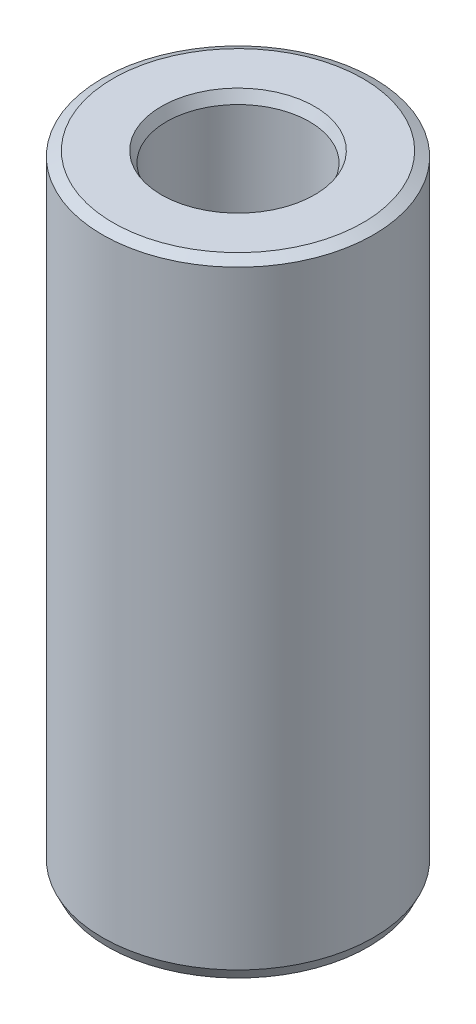
from build123d import *
from OCP.BRepFilletAPI import BRepFilletAPI_MakeChamfer

# Parameters (mm, degrees)
SKETCH1_R           = 50
BOSS_EXTRUDE1_DEPTH = 230.315111073
SKETCH2_R           = 26.370165527
CUT_EXTRUDE1_DEPTH  = 241.925404199
CHAMFER1_SIZE       = 1.895094903
CHAMFER1_SIZE2      = 3.914105272


with BuildPart() as part:
    # Sketch1 → Boss-Extrude1 (new body)
    with BuildSketch(Plane(origin=(0, 0, 0), x_dir=(1, 0, 0), z_dir=(0, 1, 0))):
        Circle(SKETCH1_R)
    extrude(amount=BOSS_EXTRUDE1_DEPTH)

    # Sketch2 → Cut-Extrude1 (cut, through all)
    with BuildSketch(Plane(origin=(0, 0, 0), x_dir=(1, 0, 0), z_dir=(0, 1, 0))):
        Circle(SKETCH2_R)
    extrude(amount=CUT_EXTRUDE1_DEPTH, mode=Mode.SUBTRACT)

    # Chamfer1: one chamfer whose edges measure the first distance from different faces: ONE call of the kernel's chamfer builder (chamfer() names one face for all edges)
    chamfer1_edges_1 = [part.edges().sort_by_distance(p)[0] for p in [
        (-26.370165527, 230.315111073, 0),
    ]]
    chamfer1_side_1 = [part.faces().sort_by_distance(p)[0] for p in [
        (-48.585786438, 230.315111073, 0),
    ]]
    chamfer1_edges_2 = [part.edges().sort_by_distance(p)[0] for p in [
        (-26.370165527, 0, 0),
    ]]
    chamfer1_side_2 = [part.faces().sort_by_distance(p)[0] for p in [
        (-26.370165527, 115.157555537, 0),
    ]]
    chamfer1_edges_3 = [part.edges().sort_by_distance(p)[0] for p in [
        (-50, 0, 0),
    ]]
    chamfer1_side_3 = [part.faces().sort_by_distance(p)[0] for p in [
        (-48.585786438, 0, 0),
    ]]
    chamfer1_edges_4 = [part.edges().sort_by_distance(p)[0] for p in [
        (-50, 230.315111073, 0),
    ]]
    chamfer1_side_4 = [part.faces().sort_by_distance(p)[0] for p in [
        (-50, 115.157555537, 0),
    ]]
    chamfer1 = BRepFilletAPI_MakeChamfer(part.part.solid().wrapped)
    for e in chamfer1_edges_1:
        chamfer1.Add(CHAMFER1_SIZE, CHAMFER1_SIZE2, e.wrapped, chamfer1_side_1[0].wrapped)  # the first distance lies on this face
    for e in chamfer1_edges_2:
        chamfer1.Add(CHAMFER1_SIZE, CHAMFER1_SIZE2, e.wrapped, chamfer1_side_2[0].wrapped)  # the first distance lies on this face
    for e in chamfer1_edges_3:
        chamfer1.Add(CHAMFER1_SIZE, CHAMFER1_SIZE2, e.wrapped, chamfer1_side_3[0].wrapped)  # the first distance lies on this face
    for e in chamfer1_edges_4:
        chamfer1.Add(CHAMFER1_SIZE, CHAMFER1_SIZE2, e.wrapped, chamfer1_side_4[0].wrapped)  # the first distance lies on this face
    add(Compound.cast(chamfer1.Shape()), mode=Mode.REPLACE)


solid = part.part
